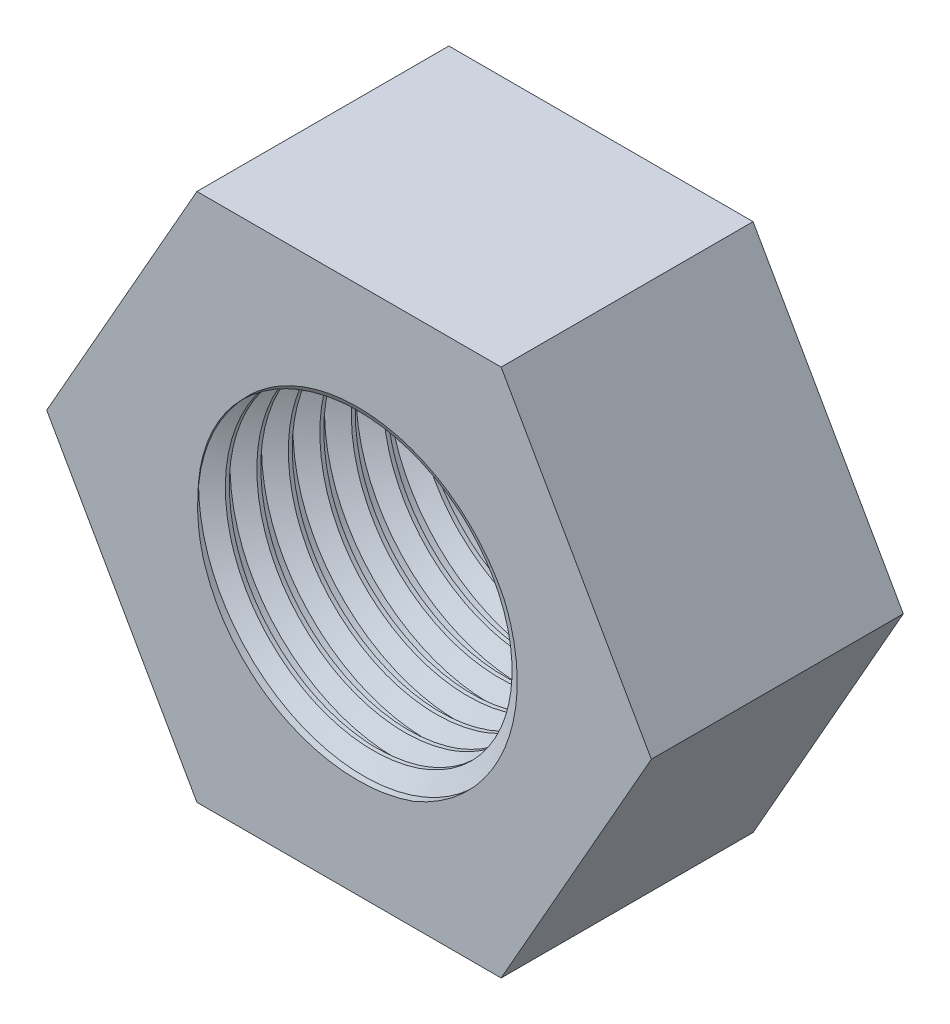
from build123d import *

# Parameters (mm, degrees)
SKETCH1_R           = 6
BOSS_EXTRUDE1_DEPTH = 10
THREAD1_PITCH       = 1.25


with BuildPart() as part:
    # Sketch1 → Boss-Extrude1 (new body)
    with BuildSketch(Plane.XY):
        Polygon((-12, 0), (-6.03742995, -10.5), (6.03742995, -10.5), (12, 0), (6.03742995, 10.5), (-6.03742995, 10.5), align=None)
        Circle(SKETCH1_R, mode=Mode.SUBTRACT)
    extrude(amount=BOSS_EXTRUDE1_DEPTH)

    # Thread1: the profile of Thread Profile1 profile screwed along a right-hand helix of 20 turns, 8 arcs to a turn; built about Z, then put on its axis
    thread1_z = Axis((0, 0, 0), (0, 0, 1))
    thread1_corners = [(5.9997, 0, -0.000173205), (5.9997, 0, 1.093923202), (6.676582344, 0, 0.703124998), (6.676582344, 0, 0.390624998)]
    with BuildLine(mode=Mode.PRIVATE) as thread1_profile:
        Line(thread1_corners[0], thread1_corners[1])
        Line(thread1_corners[1], thread1_corners[2])
        Line(thread1_corners[2], thread1_corners[3])
        Line(thread1_corners[3], thread1_corners[0])
    thread1_cap = Face(thread1_profile.wire())
    thread1_turn_angles = [0, 22.5, 45, 67.5, 90, 112.5, 135, 157.5, 180, 202.5, 225, 247.5, 270, 292.5, 315, 337.5, 360]
    thread1_turn_weights = [1, 0.9238795325112867, 1, 0.9238795325112867, 1, 0.9238795325112867, 1, 0.9238795325112867, 1, 0.9238795325112867, 1, 0.9238795325112867, 1, 0.9238795325112867, 1, 0.9238795325112867, 1]
    thread1_turn_rails = [Edge.make_bspline([Vector(p[0], p[1], 0).rotate(thread1_z, thread1_turn_angles[k]) / thread1_turn_weights[k] + Vector(0, 0, p[2] + THREAD1_PITCH * thread1_turn_angles[k] / 360) for k in range(17)], [0, 0, 0, 1, 1, 2, 2, 3, 3, 4, 4, 5, 5, 6, 6, 7, 7, 8, 8, 8], 2, thread1_turn_weights) for p in thread1_corners]
    thread1_turn_sides = [Face.make_surface_from_curves(thread1_turn_rails[p[0]], thread1_turn_rails[p[1]]) for p in [(0, 1), (1, 2), (2, 3), (3, 0)]]
    thread1 = Plane(origin=(0, 0, 20), x_dir=(-1, 0, 0), z_dir=(0, 0, -1)) * Solid(Shell([*[p.moved(Location((0, 0, THREAD1_PITCH * i))) for i in range(20) for p in thread1_turn_sides], thread1_cap, thread1_cap.rotate(thread1_z, 7200).moved(Location((0, 0, THREAD1_PITCH * 7200 / 360)))]))
    add(thread1, mode=Mode.SUBTRACT)


solid = part.part
